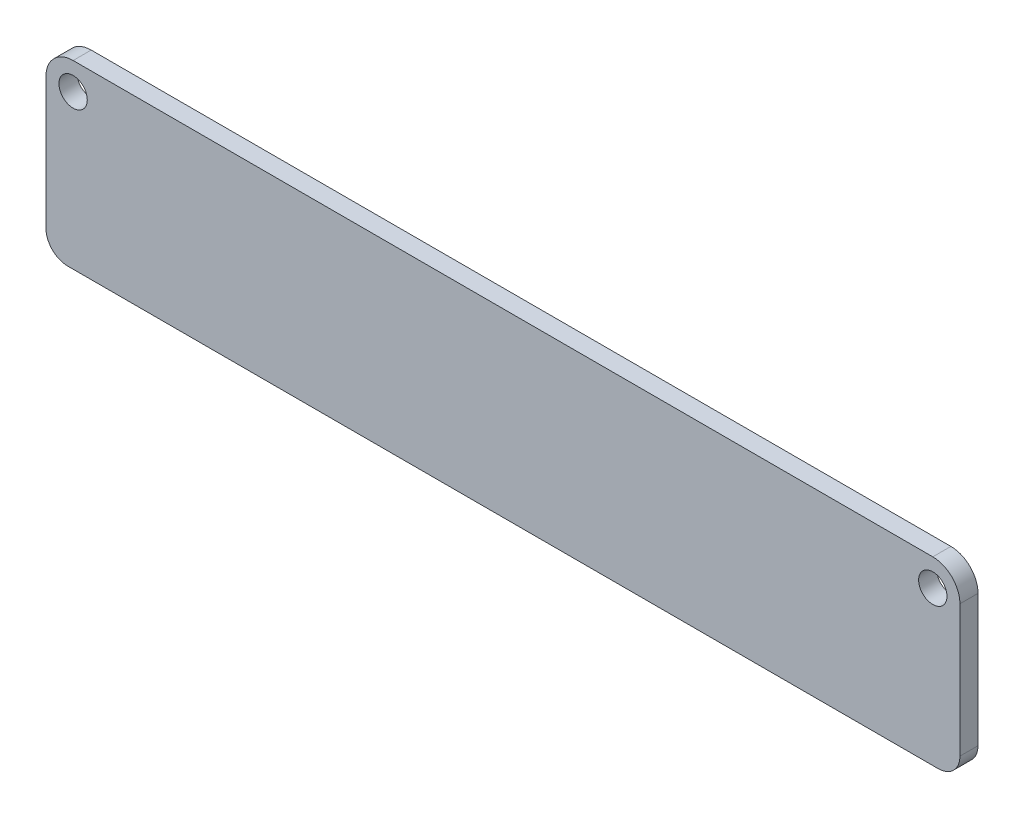
from build123d import *

# Parameters (mm, degrees)
SKETCH1_R           = 2.4892
BOSS_EXTRUDE1_DEPTH = 3.175
FILLET1_R           = 3.81


with BuildPart() as part:
    # Sketch1 → Boss-Extrude1 (new body)
    with BuildSketch(Plane.XY):
        with BuildLine():
            Line((-160.528, 0), (0, 0))
            Line((0, 0), (0, 26.9875))
            ThreePointArc((0, 26.9875), (-1.394903955, 30.355096045), (-4.7625, 31.75))
            Line((-4.7625, 31.75), (-155.7655, 31.75))
            ThreePointArc((-155.7655, 31.75), (-159.133096045, 30.355096045), (-160.528, 26.9875))
            Line((-160.528, 26.9875), (-160.528, 0))
        make_face()
        with Locations((-155.7655, 26.9875)):
            Circle(SKETCH1_R, mode=Mode.SUBTRACT)
        with Locations((-4.7625, 26.9875)):
            Circle(SKETCH1_R, mode=Mode.SUBTRACT)
    extrude(amount=BOSS_EXTRUDE1_DEPTH)

    # Fillet1
    fillet1_edges = [part.edges().sort_by_distance(p)[0] for p in [
        (-160.528, 0, 1.5875),
        (0, 0, 1.5875),
    ]]
    fillet(fillet1_edges, radius=FILLET1_R)


solid = part.part
